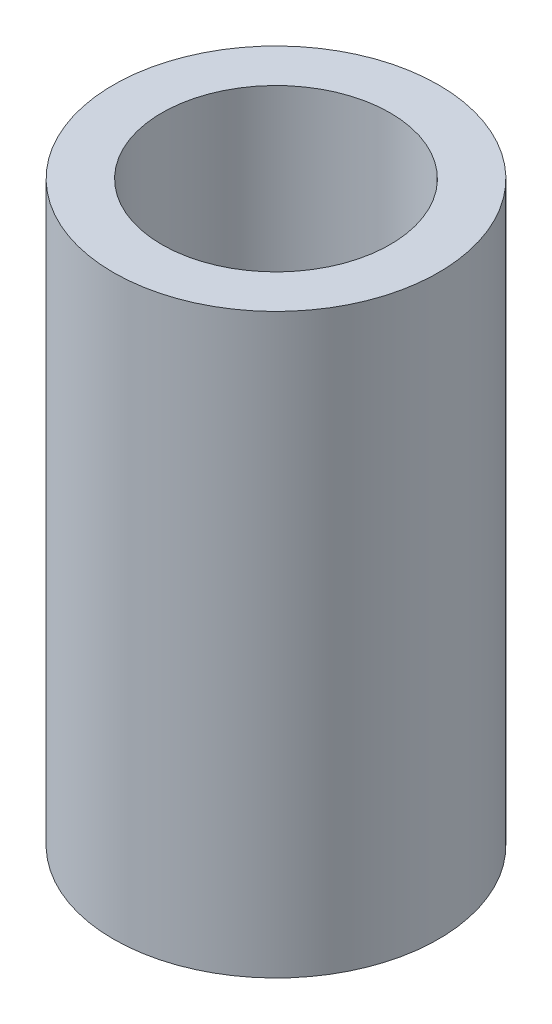
from build123d import *

# Parameters (mm, degrees)
SKETCH1_R           = 25
BOSS_EXTRUDE1_DEPTH = 88.772712368
SKETCH2_R           = 17.556006194
CUT_EXTRUDE1_DEPTH  = 96.554144134


with BuildPart() as part:
    # Sketch1 → Boss-Extrude1 (new body)
    with BuildSketch(Plane(origin=(0, 0, 0), x_dir=(1, 0, 0), z_dir=(0, 1, 0))):
        Circle(SKETCH1_R)
    extrude(amount=BOSS_EXTRUDE1_DEPTH)

    # Sketch2 → Cut-Extrude1 (cut, through all)
    with BuildSketch(Plane(origin=(0, 0, 0), x_dir=(1, 0, 0), z_dir=(0, 1, 0))):
        Circle(SKETCH2_R)
    extrude(amount=CUT_EXTRUDE1_DEPTH, mode=Mode.SUBTRACT)


solid = part.part
